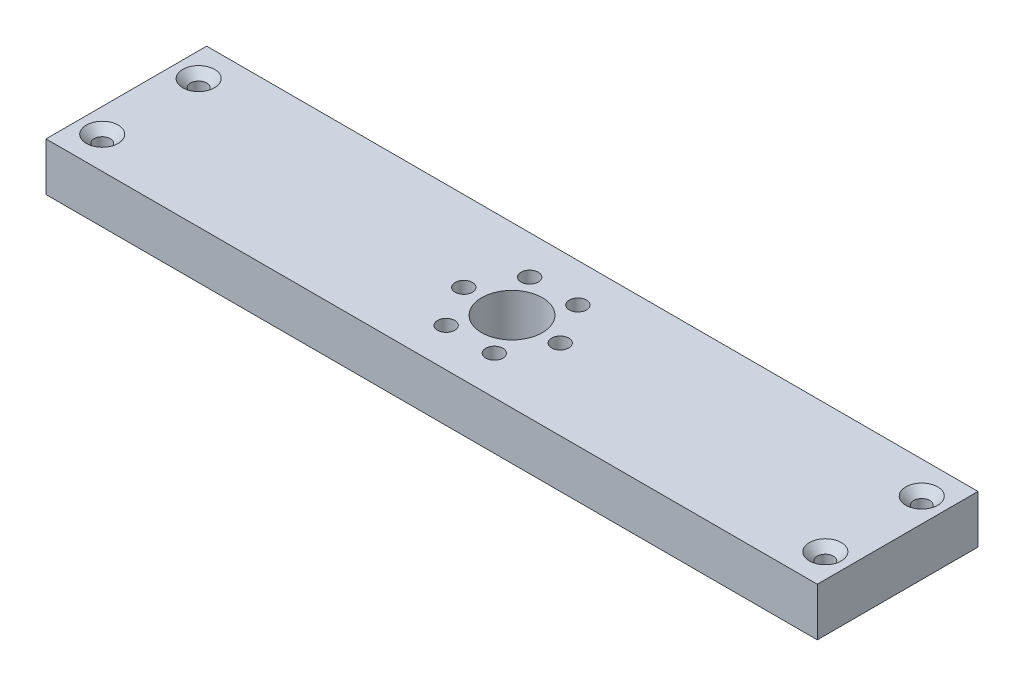
from build123d import *

# Parameters (mm, degrees)
SKETCH1_W                                       = 152.4
SKETCH1_H                                       = 31.75
BOSS_EXTRUDE1_DEPTH                             = 4.7625
CSK_FOR_M3_FLAT_HEAD_MACHINE_SCREW1_D           = 3.2
CSK_FOR_M3_FLAT_HEAD_MACHINE_SCREW1_CSINK_D     = 6.3
CSK_FOR_M3_FLAT_HEAD_MACHINE_SCREW1_CSINK_ANGLE = 90
F_12_0MM_DOWEL_HOLE1_D                          = 12
CBORE_FOR_M3_SHCS1_D                            = 3.4
CBORE_FOR_M3_SHCS1_CBORE_D                      = 4.5
CBORE_FOR_M3_SHCS1_CBORE_DEPTH                  = 2


with BuildPart() as part:
    # Sketch1 → Boss-Extrude1 (new, symmetric)
    with BuildSketch(Plane(origin=(0, 0, 0), x_dir=(1, 0, 0), z_dir=(0, 1, 0))):
        Rectangle(SKETCH1_W, SKETCH1_H)
    extrude(amount=BOSS_EXTRUDE1_DEPTH, both=True)

    # CSK for M3 Flat Head Machine Screw1 (through all)
    with Locations(Plane(origin=(0, 4.7625, 0), x_dir=(1, 0, 0), z_dir=(0, 1, 0))):
        with Locations((-71.4375, 9.525), (-71.4375, -9.525), (71.4375, 9.525), (71.4375, -9.525)):
            CounterSinkHole(CSK_FOR_M3_FLAT_HEAD_MACHINE_SCREW1_D / 2, CSK_FOR_M3_FLAT_HEAD_MACHINE_SCREW1_CSINK_D / 2, counter_sink_angle=CSK_FOR_M3_FLAT_HEAD_MACHINE_SCREW1_CSINK_ANGLE)

    # Ø12.0mm Dowel Hole1 (through all)
    with Locations(Plane(origin=(0, -4.7625, 0), x_dir=(-1, 0, 0), z_dir=(0, -1, 0))):
        with Locations((0, 0)):
            Hole(F_12_0MM_DOWEL_HOLE1_D / 2)

    # CBORE for M3 SHCS1 (through all)
    with Locations(Plane(origin=(0, -4.7625, 0), x_dir=(-1, 0, 0), z_dir=(0, -1, 0))):
        with Locations((4.7625, -8.248891971), (9.525, 0), (4.7625, 8.248891971), (-4.7625, 8.248891971), (-9.525, 0), (-4.7625, -8.248891971)):
            CounterBoreHole(CBORE_FOR_M3_SHCS1_D / 2, CBORE_FOR_M3_SHCS1_CBORE_D / 2, CBORE_FOR_M3_SHCS1_CBORE_DEPTH)


solid = part.part
